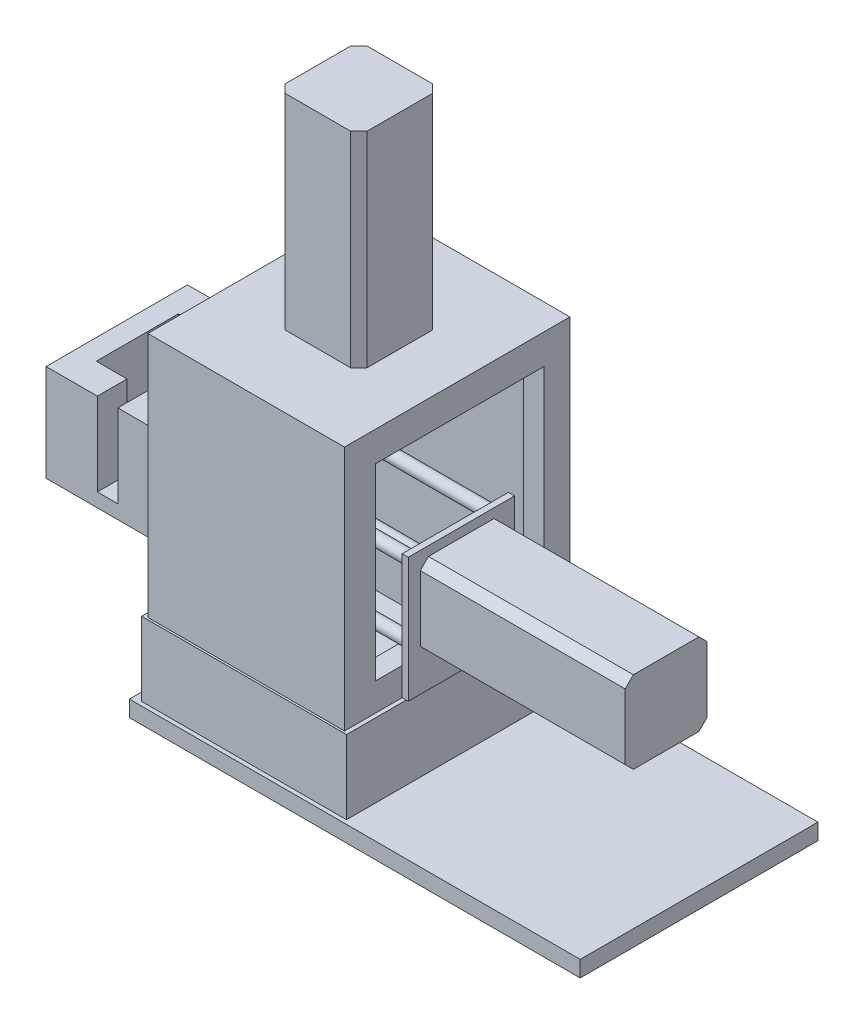
from build123d import *

# Parameters (mm, degrees)
SKETCH1_W            = 279.4
SKETCH1_H            = 147.32
BOSS_EXTRUDE1_DEPTH  = 10
SKETCH2_W            = 127
SKETCH2_H            = 142.24
BOSS_EXTRUDE2_DEPTH  = 45.72
SKETCH3_W            = 121.92
SKETCH3_H            = 139.7
BOSS_EXTRUDE3_DEPTH  = 152.4
SHELL1_START         = -130.81
SHELL1_DEPTH         = 114.3
SHELL1_START_2       = -132.08
SHELL1_2_OUTLINE_W   = 101.6
SHELL1_2_OUTLINE_H   = 30.32
SHELL1_2_DEPTH       = 116.84
SKETCH5_W            = 104.57255138
SKETCH5_H            = 116.526725643
CUT_EXTRUDE1_DEPTH   = 152.4
CUT_EXTRUDE2_REACH   = 380.261
SKETCH6_W            = 38.1
SKETCH6_H            = 38.1
SKETCH7_W            = 50.8
SKETCH7_H            = 50.8
BOSS_EXTRUDE4_DEPTH  = 127
SKETCH8_R            = 6.35
BOSS_EXTRUDE5_DEPTH  = 50.8
SKETCH9_W            = 38.1
SKETCH9_H            = 38.1
BOSS_EXTRUDE6_DEPTH  = 7.62
CHAMFER1_SIZE        = 5.08
SKETCH11_W           = 65.909153677
SKETCH11_H           = 77.291627037
BOSS_EXTRUDE8_DEPTH  = 3.81
SKETCH12_W           = 50.8
SKETCH12_H           = 50.8
BOSS_EXTRUDE9_DEPTH  = 127
CHAMFER2_SIZE        = 5.08
SKETCH13_R           = 3.81
BOSS_EXTRUDE10_DEPTH = 127
SKETCH14_W           = 65.909153677
SKETCH14_H           = 59.998529599
BOSS_EXTRUDE11_DEPTH = 10.16
SKETCH15_W           = 87.63
SKETCH15_H           = 59.998529599
BOSS_EXTRUDE12_DEPTH = 10.16
BOSS_EXTRUDE13_DEPTH = 19.05
SKETCH17_W           = 87.63
SKETCH17_H           = 8.552313921
BOSS_EXTRUDE14_DEPTH = 12.7
BOSS_EXTRUDE15_DEPTH = 19.05
SKETCH19_W           = 87.63
SKETCH19_H           = 59.998529599
BOSS_EXTRUDE16_DEPTH = 12.7


# Read off the part's stored shape, not the designer's step: Shell1
with BuildPart() as part:
    # Sketch1 → Boss-Extrude1 (new body)
    with BuildSketch(Plane(origin=(0, 0, 0), x_dir=(1, 0, 0), z_dir=(0, 1, 0))):
        with Locations((139.7, 73.66)):
            Rectangle(SKETCH1_W, SKETCH1_H)
    extrude(amount=BOSS_EXTRUDE1_DEPTH)

    # Sketch2 → Boss-Extrude2 (add)
    with BuildSketch(Plane(origin=(0, 10, 0), x_dir=(1, 0, 0), z_dir=(0, 1, 0))):
        with Locations((68.541128652, 73.66)):
            Rectangle(SKETCH2_W, SKETCH2_H)
    extrude(amount=BOSS_EXTRUDE2_DEPTH)

    # Sketch3 → Boss-Extrude3 (add)
    with BuildSketch(Plane(origin=(0, 55.72, 0), x_dir=(1, 0, 0), z_dir=(0, 1, 0))):
        with Locations((68.541128652, 73.66)):
            Rectangle(SKETCH3_W, SKETCH3_H)
    extrude(amount=BOSS_EXTRUDE3_DEPTH)

    # Shell1 outline → Shell1 (cut)
    with BuildSketch(Plane.XY.offset(SHELL1_START)):
        Polygon((17.741128652, 12.7), (119.341128652, 12.7), (119.341128652, 43.02), (116.801128652, 43.02), (116.801128652, 195.42), (20.281128652, 195.42), (20.281128652, 43.02), (17.741128652, 43.02), align=None)
    extrude(amount=SHELL1_DEPTH, mode=Mode.SUBTRACT)

    # Shell1 2 outline → Shell1 2 (cut)
    with BuildSketch(Plane.XY.offset(SHELL1_START_2)):
        with Locations((68.541128652, 27.86)):
            Rectangle(SHELL1_2_OUTLINE_W, SHELL1_2_OUTLINE_H)
    extrude(amount=SHELL1_2_DEPTH, mode=Mode.SUBTRACT)

    # Sketch5 → Cut-Extrude1 (cut)
    with BuildSketch(Plane(origin=(129.501128652, 0, 0), x_dir=(0, 0, -1), z_dir=(1, 0, 0))):
        with Locations((75.203066098, 131.276460259)):
            Rectangle(SKETCH5_W, SKETCH5_H)
    extrude(amount=-CUT_EXTRUDE1_DEPTH, mode=Mode.SUBTRACT)

    # Sketch6 → Cut-Extrude2 (cut, up to next)
    with BuildSketch(Plane(origin=(0, 208.12, 0), x_dir=(1, 0, 0), z_dir=(0, 1, 0)), mode=Mode.PRIVATE) as cut_extrude2_sk1:
        with Locations((68.541128652, 73.66)):
            Rectangle(SKETCH6_W, SKETCH6_H)
    cut_extrude2_tool1 = extrude(cut_extrude2_sk1.sketch, amount=-CUT_EXTRUDE2_REACH, mode=Mode.PRIVATE) & part.part
    add(cut_extrude2_tool1.solids().sort_by_distance((68.541129, 208.12, -73.66))[0], mode=Mode.SUBTRACT)

    # Sketch7 → Boss-Extrude4 (add)
    with BuildSketch(Plane(origin=(0, 208.12, 0), x_dir=(1, 0, 0), z_dir=(0, 1, 0))):
        with Locations((68.541128652, 73.66)):
            Rectangle(SKETCH7_W, SKETCH7_H)
    extrude(amount=BOSS_EXTRUDE4_DEPTH)

    # Sketch8 → Boss-Extrude5 (add)
    with BuildSketch(Plane.XZ.offset(-208.12)):
        with Locations(Location((68.541128652, -73.66, 0), (0, 0, 90))):
            Circle(SKETCH8_R)
    extrude(amount=BOSS_EXTRUDE5_DEPTH)

    # Sketch9 → Boss-Extrude6 (add)
    with BuildSketch(Plane.XZ.offset(-157.32)):
        with Locations((68.541128652, -73.66)):
            Rectangle(SKETCH9_W, SKETCH9_H)
    extrude(amount=BOSS_EXTRUDE6_DEPTH)

    # Chamfer1
    chamfer1_edges = [part.edges().sort_by_distance(p)[0] for p in [
        (43.141128652, 271.62, -99.06),
        (43.141128652, 271.62, -48.26),
        (93.941128652, 271.62, -48.26),
        (93.941128652, 271.62, -99.06),
    ]]
    chamfer(chamfer1_edges, length=CHAMFER1_SIZE)

    # Sketch11 → Boss-Extrude8 (add)
    with BuildSketch(Plane(origin=(129.501128652, 0, 0), x_dir=(0, 0, -1), z_dir=(1, 0, 0))):
        with Locations((72.491397984, 94.365813519)):
            Rectangle(SKETCH11_W, SKETCH11_H)
    extrude(amount=BOSS_EXTRUDE8_DEPTH)

    # Sketch12 → Boss-Extrude9 (add)
    with BuildSketch(Plane(origin=(133.311128652, 0, 0), x_dir=(0, 0, -1), z_dir=(1, 0, 0))):
        with Locations((72.356136011, 101.821276894)):
            Rectangle(SKETCH12_W, SKETCH12_H)
    extrude(amount=BOSS_EXTRUDE9_DEPTH)

    # Chamfer2
    chamfer2_edges = [part.edges().sort_by_distance(p)[0] for p in [
        (196.811128652, 127.221276894, -46.956136011),
        (196.811128652, 76.421276894, -46.956136011),
        (196.811128652, 76.421276894, -97.756136011),
        (196.811128652, 127.221276894, -97.756136011),
    ]]
    chamfer(chamfer2_edges, length=CHAMFER2_SIZE)

    # Sketch13 → Boss-Extrude10 (add)
    with BuildSketch(Plane.ZY.offset(-129.501128652)):
        with Locations(Location((-97.260941216, 125.126689221, 0), (0, 0, 180))):
            Circle(SKETCH13_R)
        with Locations(Location((-47.633379276, 125.126689221, 0), (0, 0, 180))):
            Circle(SKETCH13_R)
        with Locations(Location((-97.260941216, 80.811309035, 0), (0, 0, 180))):
            Circle(SKETCH13_R)
        with Locations(Location((-47.633379276, 80.811309035, 0), (0, 0, 180))):
            Circle(SKETCH13_R)
    extrude(amount=BOSS_EXTRUDE10_DEPTH)

    # Sketch14 → Boss-Extrude11 (add)
    with BuildSketch(Plane.ZY.offset(-2.501128652)):
        with Locations((-72.491397984, 103.012362238)):
            Rectangle(SKETCH14_W, SKETCH14_H)
    extrude(amount=BOSS_EXTRUDE11_DEPTH)

    # Sketch15 → Boss-Extrude12 (add)
    with BuildSketch(Plane.ZY.offset(7.658871348)):
        with Locations((-73.497023893, 103.012362238)):
            Rectangle(SKETCH15_W, SKETCH15_H)
    extrude(amount=BOSS_EXTRUDE12_DEPTH)

    # Sketch16 → Boss-Extrude13 (add)
    with BuildSketch(Plane.ZY.offset(17.818871348)):
        Polygon((-117.312023893, 133.011627037), (-98.897023893, 133.011627037), (-98.897023893, 81.565411359), (-48.097023893, 81.565411359), (-48.097023893, 133.011627037), (-29.682023893, 133.011627037), (-29.682023893, 73.013097438), (-117.312023893, 73.013097438), align=None)
    extrude(amount=BOSS_EXTRUDE13_DEPTH)

    # Sketch17 → Boss-Extrude14 (add)
    with BuildSketch(Plane.ZY.offset(36.868871348)):
        with Locations((-73.497023893, 77.289254399)):
            Rectangle(SKETCH17_W, SKETCH17_H)
    extrude(amount=BOSS_EXTRUDE14_DEPTH)

    # Sketch18 → Boss-Extrude15 (add)
    with BuildSketch(Plane.ZY.offset(49.568871348)):
        Polygon((-117.312023893, 73.013097438), (-117.312023893, 133.011627037), (-98.897023893, 133.011627037), (-98.897023893, 81.565411359), (-48.097023893, 81.565411359), (-48.097023893, 133.011627037), (-29.682023893, 133.011627037), (-29.682023893, 73.013097438), align=None)
    extrude(amount=BOSS_EXTRUDE15_DEPTH)

    # Sketch19 → Boss-Extrude16 (add)
    with BuildSketch(Plane.ZY.offset(68.618871348)):
        with Locations((-73.497023893, 103.012362238)):
            Rectangle(SKETCH19_W, SKETCH19_H)
    extrude(amount=BOSS_EXTRUDE16_DEPTH)


solid = part.part
